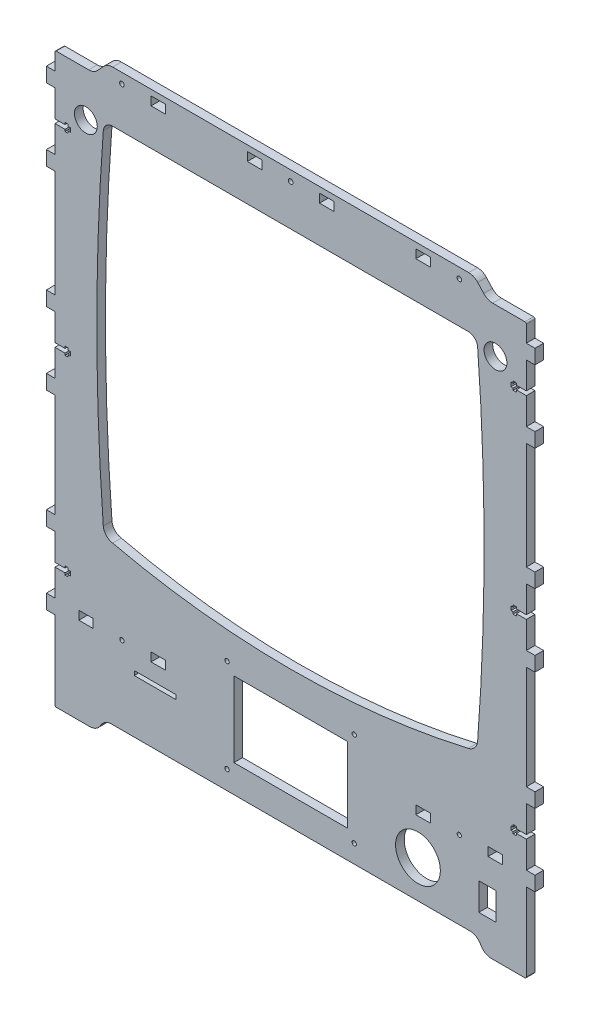
from build123d import *

# Parameters (mm, degrees)
SKETCH_1_R      = 1.5
SKETCH_1_R_2    = 15.5
SKETCH_1_R_3    = 1.6
SKETCH_1_R_4    = 7.9
SKETCH_1_W      = 10
SKETCH_1_H      = 6
SKETCH_1_W_2    = 78.6
SKETCH_1_H_2    = 51.99959895
SKETCH_1_W_3    = 12
SKETCH_1_H_3    = 19
SKETCH_1_W_4    = 29
SKETCH_1_H_4    = 3
EXTRUDE_2_DEPTH = 6


with BuildPart() as part:
    # Эскиз1 → Бобышка-Вытянуть2 (new body)
    with BuildSketch(Plane.XY):
        with BuildLine():
            Line((-162.349245127, -146.930877786), (-168.354558228, -146.930877786))
            Line((-168.354558228, -146.930877786), (-168.354558228, -136.930877786))
            Line((-168.354558228, -136.930877786), (-162.354558228, -136.930877786))
            Line((-162.354558228, -136.930877786), (-162.354558228, -118.320877786))
            Line((-162.354558228, -118.320877786), (-155.442615928, -118.320877786))
            Line((-155.442615928, -118.320877786), (-155.442615928, -119.72098181))
            Line((-155.442615928, -119.72098181), (-153.241793345, -119.72098181))
            Line((-153.241793345, -119.72098181), (-153.241793345, -118.321100605))
            Line((-153.241793345, -118.321100605), (-151.743644127, -118.321100605))
            Line((-151.743644127, -118.321100605), (-151.743644127, -115.521795283))
            Line((-151.743644127, -115.521795283), (-153.245115684, -115.521795283))
            Line((-153.245115684, -115.521795283), (-153.245115684, -114.120877786))
            Line((-153.245115684, -114.120877786), (-155.445116095, -114.120877786))
            Line((-155.445116095, -114.120877786), (-155.445116095, -115.520877786))
            Line((-155.445116095, -115.520877786), (-162.354558228, -115.520877786))
            Line((-162.354558228, -115.520877786), (-162.354558228, -96.940877786))
            Line((-162.354558228, -96.940877786), (-168.354558228, -96.940877786))
            Line((-168.354558228, -96.940877786), (-168.354558228, -86.940877786))
            Line((-168.354558228, -86.940877786), (-162.354558228, -86.940877786))
            Line((-162.354558228, -86.940877786), (-162.354558228, -15.210877786))
            Line((-162.354558228, -15.210877786), (-168.354558228, -15.210877786))
            Line((-168.354558228, -15.210877786), (-168.354558228, -5.210877786))
            Line((-168.354558228, -5.210877786), (-162.354558228, -5.210877786))
            Line((-162.354558228, -5.210877786), (-162.354558228, 13.389122214))
            Line((-162.354558228, 13.389122214), (-155.444055652, 13.389122214))
            Line((-155.444055652, 13.389122214), (-155.444055652, 11.989017706))
            Line((-155.444055652, 11.989017706), (-153.243233069, 11.989017706))
            Line((-153.243233069, 11.989017706), (-153.243233069, 13.362239479))
            Line((-153.243233069, 13.362239479), (-151.742761748, 13.362239479))
            Line((-151.742761748, 13.362239479), (-151.742761748, 16.188530845))
            Line((-151.742761748, 16.188530845), (-153.245115684, 16.188530845))
            Line((-153.245115684, 16.188530845), (-153.245115684, 17.589122214))
            Line((-153.245115684, 17.589122214), (-155.445116095, 17.589122214))
            Line((-155.445116095, 17.589122214), (-155.445116095, 16.189122214))
            Line((-155.445116095, 16.189122214), (-162.354558228, 16.189122214))
            Line((-162.354558228, 16.189122214), (-162.354558228, 34.789122214))
            Line((-162.354558228, 34.789122214), (-168.354558228, 34.789122214))
            Line((-168.354558228, 34.789122214), (-168.354558228, 44.789122214))
            Line((-168.354558228, 44.789122214), (-162.354558228, 44.789122214))
            Line((-162.354558228, 44.789122214), (-162.354558228, 118.949122214))
            Line((-162.354558228, 118.949122214), (-168.354558228, 118.949122214))
            Line((-168.354558228, 118.949122214), (-168.354558228, 128.949122214))
            Line((-168.354558228, 128.949122214), (-162.354558228, 128.949122214))
            Line((-162.354558228, 128.949122214), (-162.354558228, 147.549122214))
            Line((-162.354558228, 147.549122214), (-155.444087484, 147.549122214))
            Line((-155.444087484, 147.549122214), (-155.444087484, 146.149017702))
            Line((-155.444087484, 146.149017702), (-153.243264902, 146.149017702))
            Line((-153.243264902, 146.149017702), (-153.243264902, 147.548898907))
            Line((-153.243264902, 147.548898907), (-151.737469071, 147.548898907))
            Line((-151.737469071, 147.548898907), (-151.737951164, 150.348204717))
            Line((-151.737951164, 150.348204717), (-153.239802583, 150.348204717))
            Line((-153.239802583, 150.348204717), (-153.239802583, 151.749122214))
            Line((-153.239802583, 151.749122214), (-155.439802995, 151.749122214))
            Line((-155.439802995, 151.749122214), (-155.439802995, 150.349122214))
            Line((-155.439802995, 150.349122214), (-162.349245127, 150.349122214))
            Line((-162.349245127, 150.349122214), (-162.349245127, 168.949122214))
            Line((-162.349245127, 168.949122214), (-168.349245127, 168.949122214))
            Line((-168.349245127, 168.949122214), (-168.349245127, 178.949122214))
            Line((-168.349245127, 178.949122214), (-162.349245127, 178.949122214))
            Line((-162.349245127, 178.949122214), (-162.349245127, 190.349122214))
            ThreePointArc((-162.349245127, 190.349122214), (-162.144381362, 191.019766001), (-161.525304034, 191.349122214))
            Line((-161.525304034, 191.349122214), (-139.092392644, 191.349122214))
            ThreePointArc((-139.092392644, 191.349122214), (-135.666701236, 192.070006687), (-132.82207518, 194.110383773))
            Line((-132.82207518, 194.110383773), (-128.724185584, 198.587860655))
            ThreePointArc((-128.724185584, 198.587860655), (-125.879559527, 200.62823774), (-122.453868119, 201.349122214))
            Line((-122.453868119, 201.349122214), (123.955377865, 201.349122214))
            ThreePointArc((123.955377865, 201.349122214), (127.381069274, 200.62823774), (130.22569533, 198.587860655))
            Line((130.22569533, 198.587860655), (134.323584926, 194.110383773))
            ThreePointArc((134.323584926, 194.110383773), (137.168210982, 192.070006687), (140.59390239, 191.349122214))
            Line((140.59390239, 191.349122214), (162.850754873, 191.349122214))
            ThreePointArc((162.850754873, 191.349122214), (163.557861654, 191.056228995), (163.850754873, 190.349122214))
            Line((163.850754873, 190.349122214), (163.850754873, 178.949122214))
            Line((163.850754873, 178.949122214), (169.850754873, 178.949122214))
            Line((169.850754873, 178.949122214), (169.850754873, 168.949122214))
            Line((169.850754873, 168.949122214), (163.850754873, 168.949122214))
            Line((163.850754873, 168.949122214), (163.850754873, 150.349122214))
            Line((163.850754873, 150.349122214), (156.938753666, 150.349122214))
            Line((156.938753666, 150.349122214), (156.938753666, 151.74917383))
            Line((156.938753666, 151.74917383), (154.741012446, 151.74917383))
            Line((154.741012446, 151.74917383), (154.741012446, 150.349292624))
            Line((154.741012446, 150.349292624), (153.241012446, 150.349292624))
            Line((153.241012446, 150.349292624), (153.241012446, 147.550209336))
            Line((153.241012446, 147.550209336), (154.741012446, 147.550209336))
            Line((154.741012446, 147.550209336), (154.741012446, 146.149291839))
            Line((154.741012446, 146.149291839), (156.941736218, 146.149291839))
            Line((156.941736218, 146.149291839), (156.941736218, 147.549122214))
            Line((156.941736218, 147.549122214), (163.851237257, 147.549122214))
            Line((163.851237257, 147.549122214), (163.851237257, 128.949122214))
            Line((163.851237257, 128.949122214), (169.851237081, 128.949122214))
            Line((169.851237081, 128.949122214), (169.851237081, 118.949122214))
            Line((169.851237081, 118.949122214), (163.851237081, 118.949122214))
            Line((163.851237081, 118.949122214), (163.851237081, 44.789122214))
            Line((163.851237081, 44.789122214), (169.851237081, 44.789122214))
            Line((169.851237081, 44.789122214), (169.851237081, 34.789122214))
            Line((169.851237081, 34.789122214), (163.851237081, 34.789122214))
            Line((163.851237081, 34.789122214), (163.851237081, 16.189122214))
            Line((163.851237081, 16.189122214), (156.939202586, 16.189122214))
            Line((156.939202586, 16.189122214), (156.939202586, 17.562103605))
            Line((156.939202586, 17.562103605), (154.739101533, 17.562103605))
            Line((154.739101533, 17.562103605), (154.739101533, 16.189291862))
            Line((154.739101533, 16.189291862), (153.239956889, 16.189291862))
            Line((153.239956889, 16.189291862), (153.239956889, 13.39020884))
            Line((153.239956889, 13.39020884), (154.741461365, 13.39020884))
            Line((154.741461365, 13.39020884), (154.741461365, 11.989291851))
            Line((154.741461365, 11.989291851), (156.941702753, 11.989291851))
            Line((156.941702753, 11.989291851), (156.941702753, 13.389122214))
            Line((156.941702753, 13.389122214), (163.851237081, 13.389122214))
            Line((163.851237081, 13.389122214), (163.851237081, -5.210877786))
            Line((163.851237081, -5.210877786), (169.851237081, -5.210877786))
            Line((169.851237081, -5.210877786), (169.851237081, -15.210877786))
            Line((169.851237081, -15.210877786), (163.851237081, -15.210877786))
            Line((163.851237081, -15.210877786), (163.851237081, -86.940877786))
            Line((163.851237081, -86.940877786), (169.851237081, -86.940877786))
            Line((169.851237081, -86.940877786), (169.851237081, -96.940877786))
            Line((169.851237081, -96.940877786), (163.939237081, -96.940877786))
            Line((163.939237081, -96.940877786), (163.939237081, -115.520877786))
            Line((163.939237081, -115.520877786), (156.93923577, -115.520877786))
            Line((156.93923577, -115.520877786), (156.93923577, -114.122358317))
            Line((156.93923577, -114.122358317), (154.738205666, -114.122358317))
            Line((154.738205666, -114.122358317), (154.738205666, -115.522239523))
            Line((154.738205666, -115.522239523), (153.238413576, -115.522239523))
            Line((153.238413576, -115.522239523), (153.238413576, -118.322187164))
            Line((153.238413576, -118.322187164), (154.740539372, -118.322187164))
            Line((154.740539372, -118.322187164), (154.740539372, -119.723103854))
            Line((154.740539372, -119.723103854), (156.939923762, -119.723103854))
            Line((156.939923762, -119.723103854), (156.939923762, -118.320877786))
            Line((156.939923762, -118.320877786), (163.851344603, -118.320877786))
            Line((163.851344603, -118.320877786), (163.851344603, -136.930877786))
            Line((163.851344603, -136.930877786), (169.845441772, -136.930877786))
            Line((169.845441772, -136.930877786), (169.845441772, -146.930877786))
            Line((169.845441772, -146.930877786), (163.845441772, -146.930877786))
            Line((163.845441772, -146.930877786), (163.845441772, -200.973061911))
            ThreePointArc((163.845441772, -200.973061911), (163.501928515, -201.680136073), (162.762754873, -201.947675896))
            Line((162.762754873, -201.947675896), (139.726369967, -201.947675896))
            ThreePointArc((139.726369967, -201.947675896), (136.178541077, -201.14298723), (133.302992201, -198.914572468))
            Line((133.302992201, -198.914572468), (131.246288055, -195.894919373))
            ThreePointArc((131.246288055, -195.894919373), (128.327165513, -193.654997866), (124.734910288, -192.858614055))
            Line((124.734910288, -192.858614055), (-123.233400542, -192.858614055))
            ThreePointArc((-123.233400542, -192.858614055), (-126.825655767, -193.654997866), (-129.744778309, -195.894919373))
            Line((-129.744778309, -195.894919373), (-131.801482455, -198.914572469))
            ThreePointArc((-131.801482455, -198.914572469), (-134.720604996, -201.154493976), (-138.312860221, -201.950877786))
            Line((-138.312860221, -201.950877786), (-161.437304034, -201.950877786))
            ThreePointArc((-161.437304034, -201.950877786), (-162.093143033, -201.646865801), (-162.349245127, -200.970877786))
            Line((-162.349245127, -200.970877786), (-162.349245127, -146.930877786))
        make_face()
        with Locations((44.745441772, -115.136083352)):
            Circle(SKETCH_1_R, mode=Mode.SUBTRACT)
        with Locations((44.745441772, -180.385682302)):
            Circle(SKETCH_1_R, mode=Mode.SUBTRACT)
        with Locations((-43.254558228, -179.882480412)):
            Circle(SKETCH_1_R, mode=Mode.SUBTRACT)
        with Locations((-43.254558228, -115.136083352)):
            Circle(SKETCH_1_R, mode=Mode.SUBTRACT)
        with Locations((88.845441772, -166.947675896)):
            Circle(SKETCH_1_R_2, mode=Mode.SUBTRACT)
        with Locations((0.750754873, 194.349122214)):
            Circle(SKETCH_1_R_3, mode=Mode.SUBTRACT)
        with Locations((-116.049245127, 194.349122214)):
            Circle(SKETCH_1_R_3, mode=Mode.SUBTRACT)
        with Locations((117.550754873, 194.349122214)):
            Circle(SKETCH_1_R_3, mode=Mode.SUBTRACT)
        with Locations((-140.999245127, 160.349122214)):
            Circle(SKETCH_1_R_4, mode=Mode.SUBTRACT)
        with Locations((142.500754873, 160.349122214)):
            Circle(SKETCH_1_R_4, mode=Mode.SUBTRACT)
        with Locations((-115.994558228, -138.947675896)):
            Circle(SKETCH_1_R, mode=Mode.SUBTRACT)
        with Locations((117.485441772, -138.947675896)):
            Circle(SKETCH_1_R, mode=Mode.SUBTRACT)
        with Locations((-90.889245127, 194.349122214)):
            Rectangle(SKETCH_1_W, SKETCH_1_H, mode=Mode.SUBTRACT)
        with Locations((92.390754873, 194.349122214)):
            Rectangle(SKETCH_1_W, SKETCH_1_H, mode=Mode.SUBTRACT)
        with Locations((92.365441772, -138.947675896)):
            Rectangle(SKETCH_1_W, SKETCH_1_H, mode=Mode.SUBTRACT)
        with Locations((142.385441772, -138.947675896)):
            Rectangle(SKETCH_1_W, SKETCH_1_H, mode=Mode.SUBTRACT)
        with Locations((-140.894558228, -138.947675896)):
            Rectangle(SKETCH_1_W, SKETCH_1_H, mode=Mode.SUBTRACT)
        with Locations((-90.874558228, -138.947675896)):
            Rectangle(SKETCH_1_W, SKETCH_1_H, mode=Mode.SUBTRACT)
        with Locations((-24.239245127, 194.349122214)):
            Rectangle(SKETCH_1_W, SKETCH_1_H, mode=Mode.SUBTRACT)
        with Locations((25.740754873, 194.349122214)):
            Rectangle(SKETCH_1_W, SKETCH_1_H, mode=Mode.SUBTRACT)
        with BuildLine():
            Line((-122.399111136, 165.873018888), (123.624117201, 165.873018888))
            ThreePointArc((123.624117201, 165.873018888), (128.051771635, 164.15368067), (130.158760923, 159.896822223))
            ThreePointArc((130.158760923, 159.896822223), (134.629570514, 41.460685741), (130.125352868, -76.974184913))
            ThreePointArc((130.125352868, -76.974184913), (127.977308293, -81.497473491), (123.648924914, -84.015276578))
            ThreePointArc((123.648924914, -84.015276578), (0.588905308, -98.015276578), (-122.471114299, -84.015276578))
            ThreePointArc((-122.471114299, -84.015276578), (-126.930378694, -81.617835611), (-128.947210492, -76.974006197))
            ThreePointArc((-128.947210492, -76.974006197), (-133.43700353, 41.461656713), (-128.934108856, 159.896822224))
            ThreePointArc((-128.934108856, 159.896822224), (-126.846261851, 164.174875124), (-122.399111136, 165.873018888))
        make_face(mode=Mode.SUBTRACT)
        with Locations((0.745441772, -147.635882827)):
            Rectangle(SKETCH_1_W_2, SKETCH_1_H_2, mode=Mode.SUBTRACT)
        with Locations((136.938754873, -169.176180946)):
            Rectangle(SKETCH_1_W_3, SKETCH_1_H_3, mode=Mode.SUBTRACT)
        with Locations((-93.004246156, -154.427084063)):
            Rectangle(SKETCH_1_W_4, SKETCH_1_H_4, mode=Mode.SUBTRACT)
    extrude(amount=EXTRUDE_2_DEPTH)


solid = part.part
